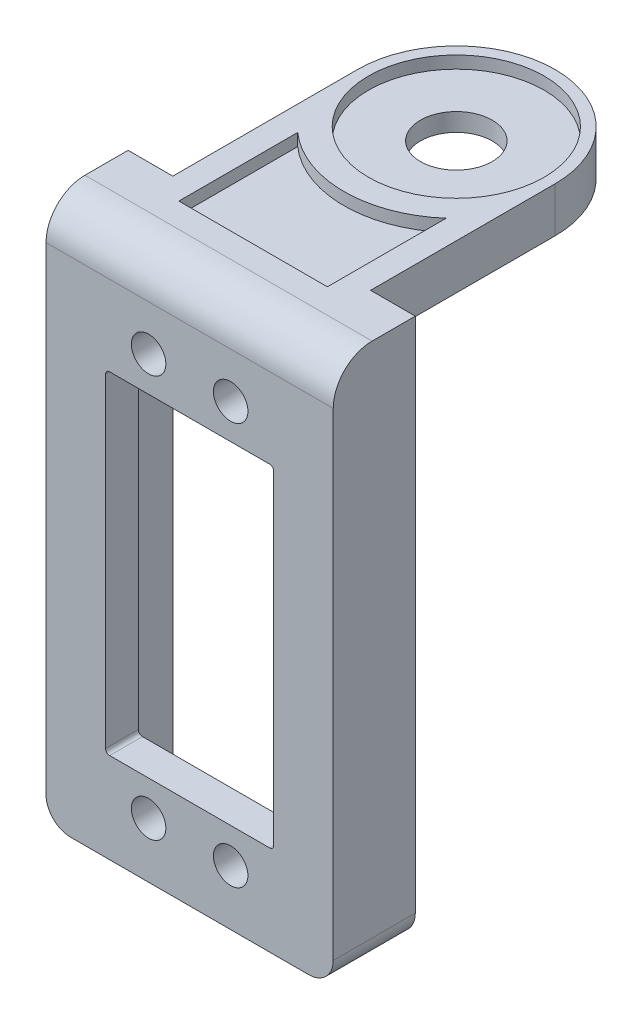
from build123d import *

# Parameters (mm, degrees)
SKETCH1_W                    = 35
SKETCH1_H                    = 64
BASE_FLANGE1_DEPTH           = 4
EDGE_FLANGE1_STRIP_W         = 17.4732
EDGE_FLANGE1_STRIP_H         = 4
EDGE_FLANGE1_STRIP_CUT_DEPTH = 35
EDGE_FLANGE1_DEPTH           = 35
CUT_EXTRUDE1_DEPTH           = 62.889013565
CUT_EXTRUDE1_DEPTH_BACK      = 62.889013565
SKETCH10_W                   = 20.5
SKETCH10_H                   = 40.5
CUT_EXTRUDE2_DEPTH           = 84.079780934
CUT_EXTRUDE2_DEPTH_BACK      = 84.079780934
SKETCH11_R                   = 4.375
FILLET1_R                    = 17
CUT_EXTRUDE3_DEPTH           = 84.079780934
CUT_EXTRUDE3_DEPTH_BACK      = 84.079780934
CUT_EXTRUDE4_DEPTH           = 58.575624182
CUT_EXTRUDE4_DEPTH_BACK      = 58.575624182
SKETCH14_R                   = 2.1
SKETCH16_R                   = 10.7
CUT_EXTRUDE5_DEPTH           = 0.3
SKETCH21_W                   = 5.45
SKETCH21_H                   = 60
BOSS_EXTRUDE1_DEPTH          = 6
SKETCH23_W                   = 35
SKETCH23_H                   = 2
BOSS_EXTRUDE2_DEPTH          = 10
FILLET2_R                    = 3
FILLET3_R                    = 0.5
FILLET4_R                    = 1
DELETEFACE1_START            = -12.05
DELETEFACE1_DEPTH            = 24.1
MOVE_FACE2_BY                = 1.5
FILLET5_R                    = 0.5
SKETCH26_R                   = 10.7
CUT_EXTRUDE6_DEPTH           = 1.5


# Read off the part's stored shape, not the designer's step: DeleteFace1
# Sheet-metal steps are written as plain solids
with BuildPart() as part:
    # Sketch1 → Base-Flange1 (new body)
    with BuildSketch(Plane.XY):
        Rectangle(SKETCH1_W, SKETCH1_H)
    extrude(amount=-BASE_FLANGE1_DEPTH)

    # Edge-Flange1 strip (across the edge) → Edge-Flange1 strip cut (cut)
    with BuildSketch(Plane(origin=(-17.5, 32, -4), x_dir=(0, -1, 0), z_dir=(1, 0, 0))):
        with Locations((-4, -2)):
            Rectangle(EDGE_FLANGE1_STRIP_W, EDGE_FLANGE1_STRIP_H)
    extrude(amount=EDGE_FLANGE1_STRIP_CUT_DEPTH, mode=Mode.SUBTRACT)

    # Edge-Flange1 section (across the edge) → Edge-Flange1 (add)
    with BuildSketch(Plane(origin=(-17.5, 32, -4), x_dir=(0, -1, 0), z_dir=(1, 0, 0))):
        with BuildLine():
            Line((0, 0.7366), (0, 46))
            Line((0, 46), (4, 46))
            Line((4, 46), (4, 0.7366))
            ThreePointArc((4, 0.7366), (4.215745145, 0.215745145), (4.7366, 0))
            Line((4.7366, 0), (4.7366, -4))
            ThreePointArc((4.7366, -4), (1.38731802, -2.61268198), (0, 0.7366))
        make_face()
    extrude(amount=EDGE_FLANGE1_DEPTH)

    # Sketch10 → Cut-Extrude1 (cut, two sides: drawn at the far end of the back side and taken through both)
    with BuildSketch(Plane.XY.offset(-CUT_EXTRUDE1_DEPTH_BACK)):
        with Locations((0, -2.75)):
            Rectangle(SKETCH10_W, SKETCH10_H)
    extrude(amount=CUT_EXTRUDE1_DEPTH + CUT_EXTRUDE1_DEPTH_BACK, mode=Mode.SUBTRACT)

    # Sketch11 → Cut-Extrude2 (cut, two sides: drawn at the far end of the back side and taken through both)
    with BuildSketch(Plane(origin=(0, 32, 0), x_dir=(1, 0, 0), z_dir=(0, 1, 0)).offset(-CUT_EXTRUDE2_DEPTH_BACK)):
        with Locations(Location((0, 32.5, 0), (0, 0, 270))):
            Circle(SKETCH11_R)
    extrude(amount=CUT_EXTRUDE2_DEPTH + CUT_EXTRUDE2_DEPTH_BACK, mode=Mode.SUBTRACT)

    # Fillet1
    fillet1_edges = [part.edges().sort_by_distance(p)[0] for p in [
        (-17.5, 30, -50),
        (17.5, 30, -50),
    ]]
    fillet(fillet1_edges, radius=FILLET1_R)

    # Sketch13 → Cut-Extrude3 (cut, two sides: drawn at the far end of the back side and taken through both)
    with BuildSketch(Plane(origin=(0, 32, 0), x_dir=(1, 0, 0), z_dir=(0, 1, 0)).offset(-CUT_EXTRUDE3_DEPTH_BACK)):
        with BuildLine():
            Line((12.05, 10), (40.591208969, 10))
            Line((40.591208969, 10), (40.591208969, 59.144369897))
            Line((40.591208969, 59.144369897), (-43.376880173, 59.144369897))
            Line((-43.376880173, 59.144369897), (-43.376880173, 10))
            Line((-43.376880173, 10), (-12.05, 10))
            Line((-12.05, 10), (-12.05, 32.499999826))
            ThreePointArc((-12.05, 32.499999826), (0, 44.55), (12.05, 32.499999826))
            Line((12.05, 32.499999826), (12.05, 10))
        make_face()
    extrude(amount=CUT_EXTRUDE3_DEPTH + CUT_EXTRUDE3_DEPTH_BACK, mode=Mode.SUBTRACT)

    # Sketch14 → Cut-Extrude4 (cut, two sides: drawn at the far end of the back side and taken through both)
    with BuildSketch(Plane.XY.offset(-CUT_EXTRUDE4_DEPTH_BACK)):
        with Locations((-5, 21.75)):
            Circle(SKETCH14_R)
        with Locations((-5, -27.25)):
            Circle(SKETCH14_R)
        with Locations((5, -27.25)):
            Circle(SKETCH14_R)
        with Locations((5, 21.75)):
            Circle(SKETCH14_R)
    extrude(amount=CUT_EXTRUDE4_DEPTH + CUT_EXTRUDE4_DEPTH_BACK, mode=Mode.SUBTRACT)

    # Sketch16 → Cut-Extrude5 (cut)
    with BuildSketch(Plane.XZ.offset(-28)):
        with Locations(Location((0, -32.5, 0), (0, 0, 270))):
            Circle(SKETCH16_R)
    extrude(amount=-CUT_EXTRUDE5_DEPTH, mode=Mode.SUBTRACT)

    # Sketch21 → Boss-Extrude1 (add)
    with BuildSketch(Plane(origin=(0, 0, -4), x_dir=(-1, 0, 0), z_dir=(0, 0, -1))):
        with Locations((-14.775, -2)):
            Rectangle(SKETCH21_W, SKETCH21_H)
        with Locations((14.775, -2)):
            Rectangle(SKETCH21_W, SKETCH21_H)
    extrude(amount=BOSS_EXTRUDE1_DEPTH)

    # Sketch23 → Boss-Extrude2 (add)
    with BuildSketch(Plane(origin=(0, 0, -10), x_dir=(-1, 0, 0), z_dir=(0, 0, -1))):
        with Locations((0, -33)):
            Rectangle(SKETCH23_W, SKETCH23_H)
    extrude(amount=-BOSS_EXTRUDE2_DEPTH)

    # Fillet2
    fillet2_edges = [part.edges().sort_by_distance(p)[0] for p in [
        (-17.5, -34, -5),
        (17.5, -34, -5),
    ]]
    fillet(fillet2_edges, radius=FILLET2_R)

    # Fillet3
    fillet3_edges = [part.edges().sort_by_distance(p)[0] for p in [
        (10.25, 17.5, -2),
        (10.25, -23, -2),
        (-10.25, -23, -2),
        (-10.25, 17.5, -2),
    ]]
    fillet(fillet3_edges, radius=FILLET3_R)

    # Fillet4
    fillet4_edges = [part.edges().sort_by_distance(p)[0] for p in [
        (12.05, -32, -7),
        (-12.05, -32, -7),
    ]]
    fillet(fillet4_edges, radius=FILLET4_R)

    # DeleteFace1 outline → DeleteFace1 (cut)
    with BuildSketch(Plane.YZ.offset(DELETEFACE1_START)):
        with BuildLine():
            ThreePointArc((27.2634, -4), (27.784254855, -4.215745145), (28, -4.7366))
            Line((28, -4.7366), (28, -4))
            Line((28, -4), (27.2634, -4))
        make_face()
    extrude(amount=DELETEFACE1_DEPTH, mode=Mode.SUBTRACT)

    # Move Face2: a face moved outward by 1.5
    extrude(part.faces().sort_by_distance((0, 28, -16.973459017))[0], amount=MOVE_FACE2_BY, dir=(0, -1, 0))

    # Fillet5
    fillet5_edges = [part.edges().sort_by_distance(p)[0] for p in [
        (0, 26.5, -4),
    ]]
    fillet(fillet5_edges, radius=FILLET5_R)

    # Sketch26 → Cut-Extrude6 (cut)
    with BuildSketch(Plane(origin=(0, 32, 0), x_dir=(1, 0, 0), z_dir=(0, 1, 0))):
        with Locations(Location((0, 32.5, 0), (0, 0, 90))):
            Circle(SKETCH26_R)
        with BuildLine():
            Line((-9.05, 22.214694949), (-9.05, 7.7366))
            Line((-9.05, 7.7366), (9.05, 7.7366))
            Line((9.05, 7.7366), (9.05, 22.214694949))
            ThreePointArc((9.05, 22.214694949), (0, 18.8), (-9.05, 22.214694949))
        make_face()
    extrude(amount=-CUT_EXTRUDE6_DEPTH, mode=Mode.SUBTRACT)


solid = part.part
